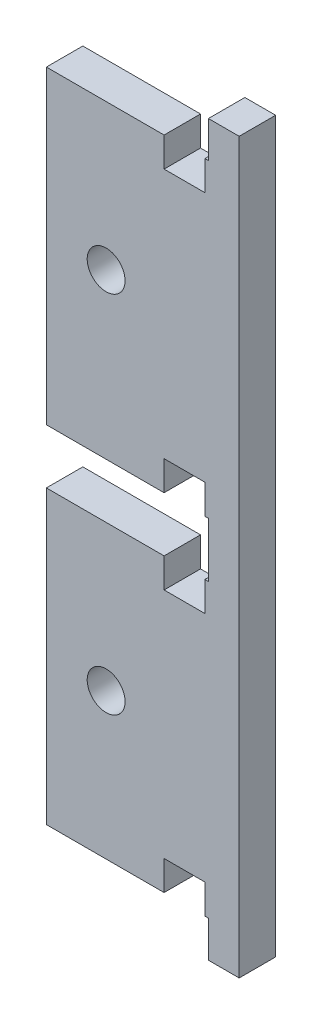
from build123d import *

# Parameters (mm, degrees)
SKETCH2_W               = 40.64
SKETCH2_H               = 127
BOSS_EXTRUDE1_DEPTH     = 6.35
M6_CLEARANCE_HOLE1_D    = 6.6
CUT_EXTRUDE1_DEPTH      = 134.495063954
CUT_EXTRUDE1_DEPTH_BACK = 134.495063954
SKETCH5_W               = 7.0505
SKETCH5_H               = 127
SKETCH6_W               = 28.23137
SKETCH6_H               = 6.35
SKETCH6_H_2             = 9.525
CUT_EXTRUDE2_DEPTH      = 134.495063954
SKETCH7_W               = 7.112
SKETCH7_H               = 5.5245
CUT_EXTRUDE3_DEPTH      = 134.495063954


with BuildPart() as part:
    # Sketch2 → Boss-Extrude1 (new body)
    with BuildSketch(Plane.XY):
        with Locations((20.32, 63.5)):
            Rectangle(SKETCH2_W, SKETCH2_H)
    extrude(amount=BOSS_EXTRUDE1_DEPTH)

    # M6 Clearance Hole1 (through all)
    with Locations(Plane.XY.offset(6.35)):
        with Locations((17.4625, 31.75), (17.4625, 95.25)):
            Hole(M6_CLEARANCE_HOLE1_D / 2)

    # Sketch5 → Cut-Extrude1 (cut, two sides: drawn at the far end of the back side and taken through both)
    with BuildSketch(Plane.XY.offset(6.35).offset(-CUT_EXTRUDE1_DEPTH_BACK)):
        with Locations((3.52525, 63.5)):
            Rectangle(SKETCH5_W, SKETCH5_H)
    extrude(amount=CUT_EXTRUDE1_DEPTH + CUT_EXTRUDE1_DEPTH_BACK, mode=Mode.SUBTRACT)

    # Sketch6 → Cut-Extrude2 (cut, through all)
    with BuildSketch(Plane.XY.offset(6.35)):
        with Locations((21.166185, 123.825)):
            Rectangle(SKETCH6_W, SKETCH6_H)
        with Locations((21.166185, 61.9125)):
            Rectangle(SKETCH6_W, SKETCH6_H_2)
        with Locations((21.166185, 3.175)):
            Rectangle(SKETCH6_W, SKETCH6_H)
    extrude(amount=-CUT_EXTRUDE2_DEPTH, mode=Mode.SUBTRACT)

    # Sketch7 → Cut-Extrude3 (cut, through all)
    with BuildSketch(Plane.XY.offset(6.35)):
        with Locations((31.115, 118.26875)):
            Rectangle(SKETCH7_W, SKETCH7_H)
        with Locations((31.115, 69.05625)):
            Rectangle(SKETCH7_W, SKETCH7_H)
        with Locations((31.115, 54.76875)):
            Rectangle(SKETCH7_W, SKETCH7_H)
        with Locations((31.115, 8.73125)):
            Rectangle(SKETCH7_W, SKETCH7_H)
    extrude(amount=-CUT_EXTRUDE3_DEPTH, mode=Mode.SUBTRACT)


solid = part.part
